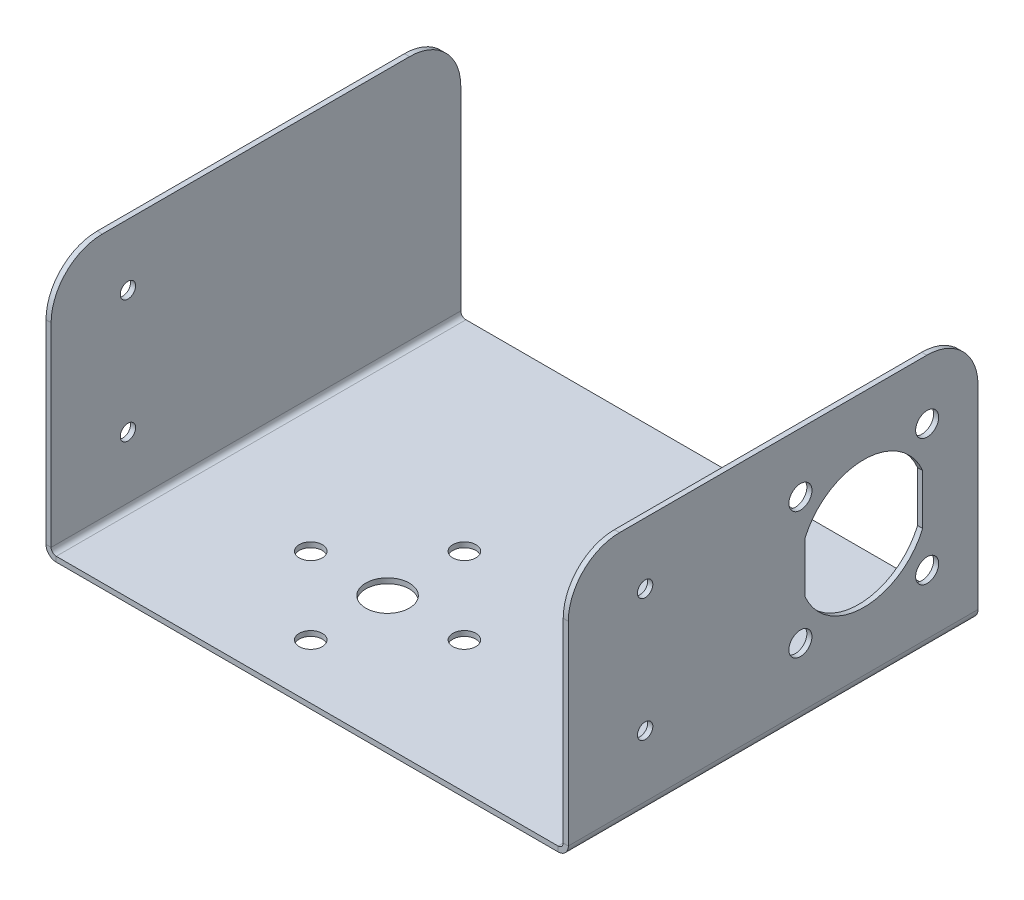
from build123d import *

# Parameters (mm, degrees)
SKETCH1_W                    = 100
SKETCH1_H                    = 80
BASE_FLANGE1_DEPTH           = 1
EDGE_FLANGE1_STRIP_W         = 6
EDGE_FLANGE1_STRIP_H         = 1
EDGE_FLANGE1_STRIP_CUT_DEPTH = 80
EDGE_FLANGE1_DEPTH           = 80
EDGE_FLANGE2_STRIP_W         = 6
EDGE_FLANGE2_STRIP_H         = 1
EDGE_FLANGE2_STRIP_CUT_DEPTH = 80
EDGE_FLANGE2_DEPTH           = 80
FILLET1_R                    = 10
SKETCH12_R                   = 2.25
CUT_EXTRUDE1_DEPTH           = 10
SKETCH14_R                   = 4.25
SKETCH14_R_2                 = 2.25
CUT_EXTRUDE3_DEPTH           = 10
SKETCH15_R                   = 1.5
CUT_EXTRUDE4_DEPTH           = 167.440085507


# Sheet-metal steps are written as plain solids
with BuildPart() as part:
    # Sketch1 → Base-Flange1 (new body)
    with BuildSketch(Plane(origin=(0, 0, 0), x_dir=(1, 0, 0), z_dir=(0, 1, 0))):
        with Locations((50, 40)):
            Rectangle(SKETCH1_W, SKETCH1_H)
    extrude(amount=-BASE_FLANGE1_DEPTH)

    # Edge-Flange1 strip (across the edge) → Edge-Flange1 strip cut (cut)
    with BuildSketch(Plane(origin=(100, 0, 0), x_dir=(-1, 0, 0), z_dir=(0, 0, -1))):
        with Locations((-2, -0.5)):
            Rectangle(EDGE_FLANGE1_STRIP_W, EDGE_FLANGE1_STRIP_H)
    extrude(amount=EDGE_FLANGE1_STRIP_CUT_DEPTH, mode=Mode.SUBTRACT)

    # Edge-Flange1 section (across the edge) → Edge-Flange1 (add)
    with BuildSketch(Plane(origin=(100, 0, 0), x_dir=(-1, 0, 0), z_dir=(0, 0, -1))):
        with BuildLine():
            Line((-1, 1), (-1, 49))
            Line((-1, 49), (0, 49))
            Line((0, 49), (0, 1))
            ThreePointArc((0, 1), (0.292893219, 0.292893219), (1, 0))
            Line((1, 0), (1, -1))
            ThreePointArc((1, -1), (-0.414213562, -0.414213562), (-1, 1))
        make_face()
    extrude(amount=EDGE_FLANGE1_DEPTH)

    # Edge-Flange2 strip (across the edge) → Edge-Flange2 strip cut (cut)
    with BuildSketch(Plane.XY.offset(-80)):
        with Locations((-2, -0.5)):
            Rectangle(EDGE_FLANGE2_STRIP_W, EDGE_FLANGE2_STRIP_H)
    extrude(amount=EDGE_FLANGE2_STRIP_CUT_DEPTH, mode=Mode.SUBTRACT)

    # Edge-Flange2 section (across the edge) → Edge-Flange2 (add)
    with BuildSketch(Plane.XY.offset(-80)):
        with BuildLine():
            Line((-1, 1), (-1, 49))
            Line((-1, 49), (0, 49))
            Line((0, 49), (0, 1))
            ThreePointArc((0, 1), (0.292893219, 0.292893219), (1, 0))
            Line((1, 0), (1, -1))
            ThreePointArc((1, -1), (-0.414213562, -0.414213562), (-1, 1))
        make_face()
    extrude(amount=EDGE_FLANGE2_DEPTH)

    # Fillet1
    fillet1_edges = [part.edges().sort_by_distance(p)[0] for p in [
        (100.5, 49, 0),
        (100.5, 49, -80),
        (-0.5, 49, -80),
        (-0.5, 49, 0),
    ]]
    fillet(fillet1_edges, radius=FILLET1_R)

    # Sketch12 → Cut-Extrude1 (cut)
    with BuildSketch(Plane(origin=(101, 81.373526732, -102.532454166), x_dir=(0, 0, 1), z_dir=(1, 0, 0))):
        with BuildLine():
            ThreePointArc((56.332454166, 61.272506218), (44.832454166, 68.873526732), (33.332454166, 61.272506218))
            Line((33.332454166, 61.272506218), (33.332454166, 51.474547246))
            ThreePointArc((33.332454166, 51.474547246), (44.832454166, 43.873526732), (56.332454166, 51.474547246))
            Line((56.332454166, 51.474547246), (56.332454166, 61.272506218))
        make_face()
        with Locations(Location((32.458085495, 68.747895403, 0), (0, 0, 270))):
            Circle(SKETCH12_R)
        with Locations(Location((57.206822836, 68.747895403, 0), (0, 0, 270))):
            Circle(SKETCH12_R)
        with Locations(Location((57.206822836, 43.999158061, 0), (0, 0, 270))):
            Circle(SKETCH12_R)
        with Locations(Location((32.458085495, 43.999158061, 0), (0, 0, 270))):
            Circle(SKETCH12_R)
    extrude(amount=-CUT_EXTRUDE1_DEPTH, mode=Mode.SUBTRACT)

    # Sketch14 → Cut-Extrude3 (cut)
    with BuildSketch(Plane(origin=(82.686654231, -1, -102.532454166), x_dir=(-1, 0, 0), z_dir=(0, -1, 0))):
        with Locations(Location((42.686654231, -76.832454166, 0), (0, 0, 90))):
            Circle(SKETCH14_R)
        with Locations(Location((57.686654231, -76.832454166, 0), (0, 0, 90))):
            Circle(SKETCH14_R_2)
        with Locations(Location((42.686654231, -61.832454166, 0), (0, 0, 90))):
            Circle(SKETCH14_R_2)
        with Locations(Location((27.686654231, -76.832454166, 0), (0, 0, 90))):
            Circle(SKETCH14_R_2)
        with Locations(Location((42.686654231, -91.832454166, 0), (0, 0, 90))):
            Circle(SKETCH14_R_2)
    extrude(amount=-CUT_EXTRUDE3_DEPTH, mode=Mode.SUBTRACT)

    # Sketch15 → Cut-Extrude4 (cut, through all)
    with BuildSketch(Plane(origin=(101, 81.373526732, -102.532454166), x_dir=(0, 0, 1), z_dir=(1, 0, 0))):
        with Locations(Location((87.532454166, 44.373526732, 0), (0, 0, 270))):
            Circle(SKETCH15_R)
        with Locations(Location((87.532454166, 68.373526732, 0), (0, 0, 270))):
            Circle(SKETCH15_R)
    extrude(amount=-CUT_EXTRUDE4_DEPTH, mode=Mode.SUBTRACT)


solid = part.part
